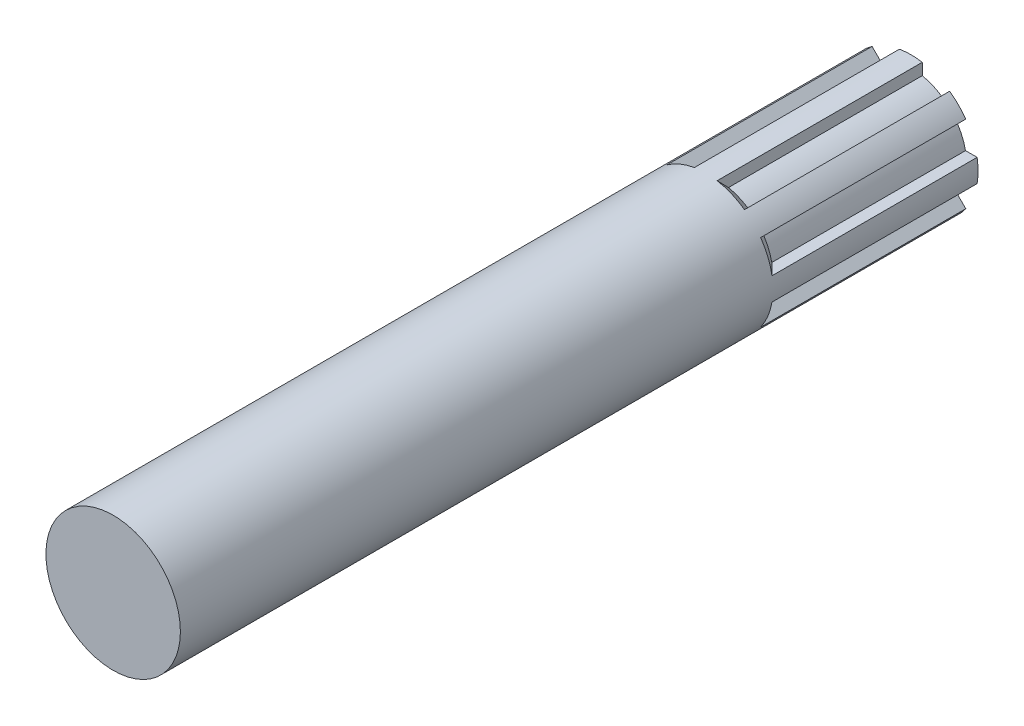
from build123d import *

# Parameters (mm, degrees)
SKETCH1_R           = 2.95
BOSS_EXTRUDE1_DEPTH = 35
CUT_EXTRUDE1_DEPTH  = 8
CHAMFER1_SIZE       = 1


with BuildPart() as part:
    # Sketch1 → Boss-Extrude1 (new body)
    with BuildSketch(Plane.XY):
        Circle(SKETCH1_R)
    extrude(amount=BOSS_EXTRUDE1_DEPTH)

    # Sketch2 → Cut-Extrude1 (cut)
    with BuildSketch(Plane(origin=(0, 0, 0), x_dir=(-1, 0, 0), z_dir=(0, 0, -1))):
        with BuildLine():
            ThreePointArc((-2.398436991, 0.5), (-2.263504855, 0.937574409), (-2.049504451, 1.34239767))
            Line((-2.049504451, 1.34239767), (-2.409337912, 1.702231131))
            ThreePointArc((-2.409337912, 1.702231131), (-2.725444621, 1.128916125), (-2.907318352, 0.5))
            Line((-2.907318352, 0.5), (-2.398436991, 0.5))
        make_face()
        with BuildLine():
            ThreePointArc((-1.34239767, 2.049504451), (-0.937574409, 2.263504855), (-0.5, 2.398436991))
            Line((-0.5, 2.398436991), (-0.5, 2.907318352))
            ThreePointArc((-0.5, 2.907318352), (-1.128916125, 2.725444621), (-1.702231131, 2.409337912))
            Line((-1.702231131, 2.409337912), (-1.34239767, 2.049504451))
        make_face()
        with BuildLine():
            Line((0.5, 2.907318352), (0.5, 2.398436991))
            ThreePointArc((0.5, 2.398436991), (0.937574409, 2.263504855), (1.34239767, 2.049504451))
            Line((1.34239767, 2.049504451), (1.702231131, 2.409337912))
            ThreePointArc((1.702231131, 2.409337912), (1.128916125, 2.725444621), (0.5, 2.907318352))
        make_face()
        with BuildLine():
            Line((2.409337912, 1.702231131), (2.049504451, 1.34239767))
            ThreePointArc((2.049504451, 1.34239767), (2.263504855, 0.937574409), (2.398436991, 0.5))
            Line((2.398436991, 0.5), (2.907318352, 0.5))
            ThreePointArc((2.907318352, 0.5), (2.725444621, 1.128916125), (2.409337912, 1.702231131))
        make_face()
        with BuildLine():
            Line((2.907318352, -0.5), (2.398436991, -0.5))
            ThreePointArc((2.398436991, -0.5), (2.263504855, -0.937574409), (2.049504451, -1.34239767))
            Line((2.049504451, -1.34239767), (2.409337912, -1.702231131))
            ThreePointArc((2.409337912, -1.702231131), (2.725444621, -1.128916125), (2.907318352, -0.5))
        make_face()
        with BuildLine():
            Line((1.702231131, -2.409337912), (1.34239767, -2.049504451))
            ThreePointArc((1.34239767, -2.049504451), (0.937574409, -2.263504855), (0.5, -2.398436991))
            Line((0.5, -2.398436991), (0.5, -2.907318352))
            ThreePointArc((0.5, -2.907318352), (1.128916125, -2.725444621), (1.702231131, -2.409337912))
        make_face()
        with BuildLine():
            ThreePointArc((-0.5, -2.398436991), (-0.937574409, -2.263504855), (-1.34239767, -2.049504451))
            Line((-1.34239767, -2.049504451), (-1.702231131, -2.409337912))
            ThreePointArc((-1.702231131, -2.409337912), (-1.128916125, -2.725444621), (-0.5, -2.907318352))
            Line((-0.5, -2.907318352), (-0.5, -2.398436991))
        make_face()
        with BuildLine():
            ThreePointArc((-2.049504451, -1.34239767), (-2.263504855, -0.937574409), (-2.398436991, -0.5))
            Line((-2.398436991, -0.5), (-2.907318352, -0.5))
            ThreePointArc((-2.907318352, -0.5), (-2.725444621, -1.128916125), (-2.409337912, -1.702231131))
            Line((-2.409337912, -1.702231131), (-2.049504451, -1.34239767))
        make_face()
    extrude(amount=-CUT_EXTRUDE1_DEPTH, mode=Mode.SUBTRACT)

    # Chamfer1
    # the kernel refuses this chamfer: 1 mm, written as the material it takes off along each edge
    with BuildSketch(Plane(origin=(0, 0, 8), x_dir=(0.6453423073627431, -0.7638935176631171, 0), z_dir=(0.7638935176631171, 0.6453423073627431, 0))) as chamfer1_piece_1_section:
        Polygon((2.95, -CHAMFER1_SIZE), (2.95 - CHAMFER1_SIZE, 0), (2.95, 0), align=None)
    chamfer1_piece_1 = revolve(axis=Axis((0, 0, 8), (0, 0, -1)), revolution_arc=125.382690704, mode=Mode.PRIVATE)
    chamfer1_piece_1 = split(chamfer1_piece_1, bisect_by=Plane(origin=(0.5, 0, 8), z_dir=(1, 0, 0)), keep=Keep.TOP, mode=Mode.PRIVATE)
    chamfer1_piece_1 = split(chamfer1_piece_1, bisect_by=Plane(origin=(-0.353553391, -0.353553391, 8), z_dir=(-0.7071067811865415, -0.7071067811865537, 0)), keep=Keep.TOP, mode=Mode.PRIVATE)
    chamfer1_piece_1 = chamfer1_piece_1 - Plane(origin=(0, 0, 8), x_dir=(0.20408163265306725, -0.9789538738948115, 0), z_dir=(0, 0, -1)) * Cylinder(2.45, 12, mode=Mode.PRIVATE)
    add(chamfer1_piece_1, mode=Mode.SUBTRACT)
    with BuildSketch(Plane(origin=(0, 0, 8), x_dir=(0.6453423073627431, -0.7638935176631171, 0), z_dir=(0.7638935176631171, 0.6453423073627431, 0))) as chamfer1_piece_2_section:
        Polygon((2.95, -CHAMFER1_SIZE), (2.95 - CHAMFER1_SIZE, 0), (2.95, 0), align=None)
    chamfer1_piece_2 = revolve(axis=Axis((0, 0, 8), (0, 0, -1)), revolution_arc=125.382690704, mode=Mode.PRIVATE)
    chamfer1_piece_2 = split(chamfer1_piece_2, bisect_by=Plane(origin=(0.353553391, -0.353553391, 8), z_dir=(0.7071067811865517, -0.7071067811865434, 0)), keep=Keep.TOP, mode=Mode.PRIVATE)
    chamfer1_piece_2 = split(chamfer1_piece_2, bisect_by=Plane(origin=(-0.5, 0, 8), z_dir=(-1, 0, 0)), keep=Keep.TOP, mode=Mode.PRIVATE)
    chamfer1_piece_2 = chamfer1_piece_2 - Plane(origin=(0, 0, 8), x_dir=(0.20408163265306725, -0.9789538738948115, 0), z_dir=(0, 0, -1)) * Cylinder(2.45, 12, mode=Mode.PRIVATE)
    add(chamfer1_piece_2, mode=Mode.SUBTRACT)
    with BuildSketch(Plane(origin=(0, 0, 8), x_dir=(0.6453423073627431, -0.7638935176631171, 0), z_dir=(0.7638935176631171, 0.6453423073627431, 0))) as chamfer1_piece_3_section:
        Polygon((2.95, -CHAMFER1_SIZE), (2.95 - CHAMFER1_SIZE, 0), (2.95, 0), align=None)
    chamfer1_piece_3 = revolve(axis=Axis((0, 0, 8), (0, 0, -1)), revolution_arc=125.382690704, mode=Mode.PRIVATE)
    chamfer1_piece_3 = split(chamfer1_piece_3, bisect_by=Plane(origin=(0, -0.5, 8), z_dir=(0, -1, 0)), keep=Keep.TOP, mode=Mode.PRIVATE)
    chamfer1_piece_3 = split(chamfer1_piece_3, bisect_by=Plane(origin=(-0.353553391, 0.353553391, 8), z_dir=(-0.7071067811865515, 0.7071067811865437, 0)), keep=Keep.TOP, mode=Mode.PRIVATE)
    chamfer1_piece_3 = chamfer1_piece_3 - Plane(origin=(0, 0, 8), x_dir=(0.20408163265306725, -0.9789538738948115, 0), z_dir=(0, 0, -1)) * Cylinder(2.45, 12, mode=Mode.PRIVATE)
    add(chamfer1_piece_3, mode=Mode.SUBTRACT)
    with BuildSketch(Plane(origin=(0, 0, 8), x_dir=(-0.083828364721268, -0.9964802081668046, 0), z_dir=(0.9964802081668046, -0.083828364721268, 0))) as chamfer1_piece_4_section:
        Polygon((2.95, -CHAMFER1_SIZE), (2.95 - CHAMFER1_SIZE, 0), (2.95, 0), align=None)
    chamfer1_piece_4 = revolve(axis=Axis((0, 0, 8), (0, 0, -1)), revolution_arc=125.382690704, mode=Mode.PRIVATE)
    chamfer1_piece_4 = split(chamfer1_piece_4, bisect_by=Plane(origin=(0.353553391, -0.353553391, 8), z_dir=(0.7071067811865517, -0.7071067811865434, 0)), keep=Keep.TOP, mode=Mode.PRIVATE)
    chamfer1_piece_4 = split(chamfer1_piece_4, bisect_by=Plane(origin=(-0.5, 0, 8), z_dir=(-1, 0, 0)), keep=Keep.TOP, mode=Mode.PRIVATE)
    chamfer1_piece_4 = chamfer1_piece_4 - Plane(origin=(0, 0, 8), x_dir=(-0.5479174163352548, -0.8365324290644679, 0), z_dir=(0, 0, -1)) * Cylinder(2.45, 12, mode=Mode.PRIVATE)
    add(chamfer1_piece_4, mode=Mode.SUBTRACT)
    with BuildSketch(Plane(origin=(0, 0, 8), x_dir=(-0.083828364721268, -0.9964802081668046, 0), z_dir=(0.9964802081668046, -0.083828364721268, 0))) as chamfer1_piece_5_section:
        Polygon((2.95, -CHAMFER1_SIZE), (2.95 - CHAMFER1_SIZE, 0), (2.95, 0), align=None)
    chamfer1_piece_5 = revolve(axis=Axis((0, 0, 8), (0, 0, -1)), revolution_arc=125.382690704, mode=Mode.PRIVATE)
    chamfer1_piece_5 = split(chamfer1_piece_5, bisect_by=Plane(origin=(0, -0.5, 8), z_dir=(0, -1, 0)), keep=Keep.TOP, mode=Mode.PRIVATE)
    chamfer1_piece_5 = split(chamfer1_piece_5, bisect_by=Plane(origin=(-0.353553391, 0.353553391, 8), z_dir=(-0.7071067811865515, 0.7071067811865437, 0)), keep=Keep.TOP, mode=Mode.PRIVATE)
    chamfer1_piece_5 = chamfer1_piece_5 - Plane(origin=(0, 0, 8), x_dir=(-0.5479174163352548, -0.8365324290644679, 0), z_dir=(0, 0, -1)) * Cylinder(2.45, 12, mode=Mode.PRIVATE)
    add(chamfer1_piece_5, mode=Mode.SUBTRACT)
    with BuildSketch(Plane(origin=(0, 0, 8), x_dir=(-0.083828364721268, -0.9964802081668046, 0), z_dir=(0.9964802081668046, -0.083828364721268, 0))) as chamfer1_piece_6_section:
        Polygon((2.95, -CHAMFER1_SIZE), (2.95 - CHAMFER1_SIZE, 0), (2.95, 0), align=None)
    chamfer1_piece_6 = revolve(axis=Axis((0, 0, 8), (0, 0, -1)), revolution_arc=125.382690704, mode=Mode.PRIVATE)
    chamfer1_piece_6 = split(chamfer1_piece_6, bisect_by=Plane(origin=(-0.353553391, -0.353553391, 8), z_dir=(-0.7071067811865454, -0.7071067811865497, 0)), keep=Keep.TOP, mode=Mode.PRIVATE)
    chamfer1_piece_6 = split(chamfer1_piece_6, bisect_by=Plane(origin=(0, 0.5, 8), z_dir=(0, 1, 0)), keep=Keep.TOP, mode=Mode.PRIVATE)
    chamfer1_piece_6 = chamfer1_piece_6 - Plane(origin=(0, 0, 8), x_dir=(-0.5479174163352548, -0.8365324290644679, 0), z_dir=(0, 0, -1)) * Cylinder(2.45, 12, mode=Mode.PRIVATE)
    add(chamfer1_piece_6, mode=Mode.SUBTRACT)
    with BuildSketch(Plane(origin=(0, 0, 8), x_dir=(-0.7638935176631205, -0.645342307362739, 0), z_dir=(0.645342307362739, -0.7638935176631205, 0))) as chamfer1_piece_7_section:
        Polygon((2.95, -CHAMFER1_SIZE), (2.95 - CHAMFER1_SIZE, 0), (2.95, 0), align=None)
    chamfer1_piece_7 = revolve(axis=Axis((0, 0, 8), (0, 0, -1)), revolution_arc=125.382690704, mode=Mode.PRIVATE)
    chamfer1_piece_7 = split(chamfer1_piece_7, bisect_by=Plane(origin=(0, -0.5, 8), z_dir=(0, -1, 0)), keep=Keep.TOP, mode=Mode.PRIVATE)
    chamfer1_piece_7 = split(chamfer1_piece_7, bisect_by=Plane(origin=(-0.353553391, 0.353553391, 8), z_dir=(-0.7071067811865515, 0.7071067811865437, 0)), keep=Keep.TOP, mode=Mode.PRIVATE)
    chamfer1_piece_7 = chamfer1_piece_7 - Plane(origin=(0, 0, 8), x_dir=(-0.9789538738948118, -0.20408163265306617, 0), z_dir=(0, 0, -1)) * Cylinder(2.45, 12, mode=Mode.PRIVATE)
    add(chamfer1_piece_7, mode=Mode.SUBTRACT)
    with BuildSketch(Plane(origin=(0, 0, 8), x_dir=(-0.7638935176631205, -0.645342307362739, 0), z_dir=(0.645342307362739, -0.7638935176631205, 0))) as chamfer1_piece_8_section:
        Polygon((2.95, -CHAMFER1_SIZE), (2.95 - CHAMFER1_SIZE, 0), (2.95, 0), align=None)
    chamfer1_piece_8 = revolve(axis=Axis((0, 0, 8), (0, 0, -1)), revolution_arc=125.382690704, mode=Mode.PRIVATE)
    chamfer1_piece_8 = split(chamfer1_piece_8, bisect_by=Plane(origin=(-0.353553391, -0.353553391, 8), z_dir=(-0.7071067811865454, -0.7071067811865497, 0)), keep=Keep.TOP, mode=Mode.PRIVATE)
    chamfer1_piece_8 = split(chamfer1_piece_8, bisect_by=Plane(origin=(0, 0.5, 8), z_dir=(0, 1, 0)), keep=Keep.TOP, mode=Mode.PRIVATE)
    chamfer1_piece_8 = chamfer1_piece_8 - Plane(origin=(0, 0, 8), x_dir=(-0.9789538738948118, -0.20408163265306617, 0), z_dir=(0, 0, -1)) * Cylinder(2.45, 12, mode=Mode.PRIVATE)
    add(chamfer1_piece_8, mode=Mode.SUBTRACT)
    with BuildSketch(Plane(origin=(0, 0, 8), x_dir=(-0.7638935176631205, -0.645342307362739, 0), z_dir=(0.645342307362739, -0.7638935176631205, 0))) as chamfer1_piece_9_section:
        Polygon((2.95, -CHAMFER1_SIZE), (2.95 - CHAMFER1_SIZE, 0), (2.95, 0), align=None)
    chamfer1_piece_9 = revolve(axis=Axis((0, 0, 8), (0, 0, -1)), revolution_arc=125.382690704, mode=Mode.PRIVATE)
    chamfer1_piece_9 = split(chamfer1_piece_9, bisect_by=Plane(origin=(-0.5, 0, 8), z_dir=(-1, 0, 0)), keep=Keep.TOP, mode=Mode.PRIVATE)
    chamfer1_piece_9 = split(chamfer1_piece_9, bisect_by=Plane(origin=(0.353553391, 0.353553391, 8), z_dir=(0.7071067811865474, 0.7071067811865477, 0)), keep=Keep.TOP, mode=Mode.PRIVATE)
    chamfer1_piece_9 = chamfer1_piece_9 - Plane(origin=(0, 0, 8), x_dir=(-0.9789538738948118, -0.20408163265306617, 0), z_dir=(0, 0, -1)) * Cylinder(2.45, 12, mode=Mode.PRIVATE)
    add(chamfer1_piece_9, mode=Mode.SUBTRACT)
    with BuildSketch(Plane(origin=(0, 0, 8), x_dir=(-0.9964802081668033, 0.08382836472128195, 0), z_dir=(-0.08382836472128195, -0.9964802081668033, 0))) as chamfer1_piece_10_section:
        Polygon((2.95, -CHAMFER1_SIZE), (2.95 - CHAMFER1_SIZE, 0), (2.95, 0), align=None)
    chamfer1_piece_10 = revolve(axis=Axis((0, 0, 8), (0, 0, -1)), revolution_arc=125.382690704, mode=Mode.PRIVATE)
    chamfer1_piece_10 = split(chamfer1_piece_10, bisect_by=Plane(origin=(-0.353553391, -0.353553391, 8), z_dir=(-0.7071067811865454, -0.7071067811865497, 0)), keep=Keep.TOP, mode=Mode.PRIVATE)
    chamfer1_piece_10 = split(chamfer1_piece_10, bisect_by=Plane(origin=(0, 0.5, 8), z_dir=(0, 1, 0)), keep=Keep.TOP, mode=Mode.PRIVATE)
    chamfer1_piece_10 = chamfer1_piece_10 - Plane(origin=(0, 0, 8), x_dir=(-0.836532429064466, 0.5479174163352577, 0), z_dir=(0, 0, -1)) * Cylinder(2.45, 12, mode=Mode.PRIVATE)
    add(chamfer1_piece_10, mode=Mode.SUBTRACT)
    with BuildSketch(Plane(origin=(0, 0, 8), x_dir=(-0.9964802081668033, 0.08382836472128195, 0), z_dir=(-0.08382836472128195, -0.9964802081668033, 0))) as chamfer1_piece_11_section:
        Polygon((2.95, -CHAMFER1_SIZE), (2.95 - CHAMFER1_SIZE, 0), (2.95, 0), align=None)
    chamfer1_piece_11 = revolve(axis=Axis((0, 0, 8), (0, 0, -1)), revolution_arc=125.382690704, mode=Mode.PRIVATE)
    chamfer1_piece_11 = split(chamfer1_piece_11, bisect_by=Plane(origin=(-0.5, 0, 8), z_dir=(-1, 0, 0)), keep=Keep.TOP, mode=Mode.PRIVATE)
    chamfer1_piece_11 = split(chamfer1_piece_11, bisect_by=Plane(origin=(0.353553391, 0.353553391, 8), z_dir=(0.7071067811865474, 0.7071067811865477, 0)), keep=Keep.TOP, mode=Mode.PRIVATE)
    chamfer1_piece_11 = chamfer1_piece_11 - Plane(origin=(0, 0, 8), x_dir=(-0.836532429064466, 0.5479174163352577, 0), z_dir=(0, 0, -1)) * Cylinder(2.45, 12, mode=Mode.PRIVATE)
    add(chamfer1_piece_11, mode=Mode.SUBTRACT)
    with BuildSketch(Plane(origin=(0, 0, 8), x_dir=(-0.9964802081668033, 0.08382836472128195, 0), z_dir=(-0.08382836472128195, -0.9964802081668033, 0))) as chamfer1_piece_12_section:
        Polygon((2.95, -CHAMFER1_SIZE), (2.95 - CHAMFER1_SIZE, 0), (2.95, 0), align=None)
    chamfer1_piece_12 = revolve(axis=Axis((0, 0, 8), (0, 0, -1)), revolution_arc=125.382690704, mode=Mode.PRIVATE)
    chamfer1_piece_12 = split(chamfer1_piece_12, bisect_by=Plane(origin=(-0.353553391, 0.353553391, 8), z_dir=(-0.7071067811865565, 0.7071067811865386, 0)), keep=Keep.TOP, mode=Mode.PRIVATE)
    chamfer1_piece_12 = split(chamfer1_piece_12, bisect_by=Plane(origin=(0.5, 0, 8), z_dir=(1, 0, 0)), keep=Keep.TOP, mode=Mode.PRIVATE)
    chamfer1_piece_12 = chamfer1_piece_12 - Plane(origin=(0, 0, 8), x_dir=(-0.836532429064466, 0.5479174163352577, 0), z_dir=(0, 0, -1)) * Cylinder(2.45, 12, mode=Mode.PRIVATE)
    add(chamfer1_piece_12, mode=Mode.SUBTRACT)
    with BuildSketch(Plane(origin=(0, 0, 8), x_dir=(0.9964802081668043, -0.08382836472127134, 0), z_dir=(0.08382836472127134, 0.9964802081668043, 0))) as chamfer1_piece_13_section:
        Polygon((2.95, -CHAMFER1_SIZE), (2.95 - CHAMFER1_SIZE, 0), (2.95, 0), align=None)
    chamfer1_piece_13 = revolve(axis=Axis((0, 0, 8), (0, 0, -1)), revolution_arc=125.382690704, mode=Mode.PRIVATE)
    chamfer1_piece_13 = split(chamfer1_piece_13, bisect_by=Plane(origin=(0.353553391, 0.353553391, 8), z_dir=(0.707106781186541, 0.7071067811865541, 0)), keep=Keep.TOP, mode=Mode.PRIVATE)
    chamfer1_piece_13 = split(chamfer1_piece_13, bisect_by=Plane(origin=(0, -0.5, 8), z_dir=(0, -1, 0)), keep=Keep.TOP, mode=Mode.PRIVATE)
    chamfer1_piece_13 = chamfer1_piece_13 - Plane(origin=(0, 0, 8), x_dir=(0.8365324290644678, -0.5479174163352549, 0), z_dir=(0, 0, -1)) * Cylinder(2.45, 12, mode=Mode.PRIVATE)
    add(chamfer1_piece_13, mode=Mode.SUBTRACT)
    with BuildSketch(Plane(origin=(0, 0, 8), x_dir=(0.9964802081668043, -0.08382836472127134, 0), z_dir=(0.08382836472127134, 0.9964802081668043, 0))) as chamfer1_piece_14_section:
        Polygon((2.95, -CHAMFER1_SIZE), (2.95 - CHAMFER1_SIZE, 0), (2.95, 0), align=None)
    chamfer1_piece_14 = revolve(axis=Axis((0, 0, 8), (0, 0, -1)), revolution_arc=125.382690704, mode=Mode.PRIVATE)
    chamfer1_piece_14 = split(chamfer1_piece_14, bisect_by=Plane(origin=(0.5, 0, 8), z_dir=(1, 0, 0)), keep=Keep.TOP, mode=Mode.PRIVATE)
    chamfer1_piece_14 = split(chamfer1_piece_14, bisect_by=Plane(origin=(-0.353553391, -0.353553391, 8), z_dir=(-0.7071067811865415, -0.7071067811865537, 0)), keep=Keep.TOP, mode=Mode.PRIVATE)
    chamfer1_piece_14 = chamfer1_piece_14 - Plane(origin=(0, 0, 8), x_dir=(0.8365324290644678, -0.5479174163352549, 0), z_dir=(0, 0, -1)) * Cylinder(2.45, 12, mode=Mode.PRIVATE)
    add(chamfer1_piece_14, mode=Mode.SUBTRACT)
    with BuildSketch(Plane(origin=(0, 0, 8), x_dir=(0.9964802081668043, -0.08382836472127134, 0), z_dir=(0.08382836472127134, 0.9964802081668043, 0))) as chamfer1_piece_15_section:
        Polygon((2.95, -CHAMFER1_SIZE), (2.95 - CHAMFER1_SIZE, 0), (2.95, 0), align=None)
    chamfer1_piece_15 = revolve(axis=Axis((0, 0, 8), (0, 0, -1)), revolution_arc=125.382690704, mode=Mode.PRIVATE)
    chamfer1_piece_15 = split(chamfer1_piece_15, bisect_by=Plane(origin=(0.353553391, -0.353553391, 8), z_dir=(0.7071067811865517, -0.7071067811865434, 0)), keep=Keep.TOP, mode=Mode.PRIVATE)
    chamfer1_piece_15 = split(chamfer1_piece_15, bisect_by=Plane(origin=(-0.5, 0, 8), z_dir=(-1, 0, 0)), keep=Keep.TOP, mode=Mode.PRIVATE)
    chamfer1_piece_15 = chamfer1_piece_15 - Plane(origin=(0, 0, 8), x_dir=(0.8365324290644678, -0.5479174163352549, 0), z_dir=(0, 0, -1)) * Cylinder(2.45, 12, mode=Mode.PRIVATE)
    add(chamfer1_piece_15, mode=Mode.SUBTRACT)
    with BuildSketch(Plane(origin=(0, 0, 8), x_dir=(0.7638935176631216, 0.6453423073627377, 0), z_dir=(-0.6453423073627377, 0.7638935176631216, 0))) as chamfer1_piece_16_section:
        Polygon((2.95, -CHAMFER1_SIZE), (2.95 - CHAMFER1_SIZE, 0), (2.95, 0), align=None)
    chamfer1_piece_16 = revolve(axis=Axis((0, 0, 8), (0, 0, -1)), revolution_arc=125.382690704, mode=Mode.PRIVATE)
    chamfer1_piece_16 = split(chamfer1_piece_16, bisect_by=Plane(origin=(0, 0.5, 8), z_dir=(0, 1, 0)), keep=Keep.TOP, mode=Mode.PRIVATE)
    chamfer1_piece_16 = split(chamfer1_piece_16, bisect_by=Plane(origin=(0.353553391, -0.353553391, 8), z_dir=(0.707106781186556, -0.707106781186539, 0)), keep=Keep.TOP, mode=Mode.PRIVATE)
    chamfer1_piece_16 = chamfer1_piece_16 - Plane(origin=(0, 0, 8), x_dir=(0.8365324290644678, -0.5479174163352549, 0), z_dir=(0, 0, -1)) * Cylinder(2.45, 12, mode=Mode.PRIVATE)
    add(chamfer1_piece_16, mode=Mode.SUBTRACT)
    with BuildSketch(Plane(origin=(0, 0, 8), x_dir=(0.7638935176631216, 0.6453423073627377, 0), z_dir=(-0.6453423073627377, 0.7638935176631216, 0))) as chamfer1_piece_17_section:
        Polygon((2.95, -CHAMFER1_SIZE), (2.95 - CHAMFER1_SIZE, 0), (2.95, 0), align=None)
    chamfer1_piece_17 = revolve(axis=Axis((0, 0, 8), (0, 0, -1)), revolution_arc=125.382690704, mode=Mode.PRIVATE)
    chamfer1_piece_17 = split(chamfer1_piece_17, bisect_by=Plane(origin=(0.353553391, 0.353553391, 8), z_dir=(0.707106781186541, 0.7071067811865541, 0)), keep=Keep.TOP, mode=Mode.PRIVATE)
    chamfer1_piece_17 = split(chamfer1_piece_17, bisect_by=Plane(origin=(0, -0.5, 8), z_dir=(0, -1, 0)), keep=Keep.TOP, mode=Mode.PRIVATE)
    chamfer1_piece_17 = chamfer1_piece_17 - Plane(origin=(0, 0, 8), x_dir=(0.8365324290644678, -0.5479174163352549, 0), z_dir=(0, 0, -1)) * Cylinder(2.45, 12, mode=Mode.PRIVATE)
    add(chamfer1_piece_17, mode=Mode.SUBTRACT)
    with BuildSketch(Plane(origin=(0, 0, 8), x_dir=(0.7638935176631216, 0.6453423073627377, 0), z_dir=(-0.6453423073627377, 0.7638935176631216, 0))) as chamfer1_piece_18_section:
        Polygon((2.95, -CHAMFER1_SIZE), (2.95 - CHAMFER1_SIZE, 0), (2.95, 0), align=None)
    chamfer1_piece_18 = revolve(axis=Axis((0, 0, 8), (0, 0, -1)), revolution_arc=125.382690704, mode=Mode.PRIVATE)
    chamfer1_piece_18 = split(chamfer1_piece_18, bisect_by=Plane(origin=(0.5, 0, 8), z_dir=(1, 0, 0)), keep=Keep.TOP, mode=Mode.PRIVATE)
    chamfer1_piece_18 = split(chamfer1_piece_18, bisect_by=Plane(origin=(-0.353553391, -0.353553391, 8), z_dir=(-0.7071067811865415, -0.7071067811865537, 0)), keep=Keep.TOP, mode=Mode.PRIVATE)
    chamfer1_piece_18 = chamfer1_piece_18 - Plane(origin=(0, 0, 8), x_dir=(0.8365324290644678, -0.5479174163352549, 0), z_dir=(0, 0, -1)) * Cylinder(2.45, 12, mode=Mode.PRIVATE)
    add(chamfer1_piece_18, mode=Mode.SUBTRACT)
    with BuildSketch(Plane(origin=(0, 0, 8), x_dir=(0.08382836472126272, 0.996480208166805, 0), z_dir=(-0.996480208166805, 0.08382836472126272, 0))) as chamfer1_piece_19_section:
        Polygon((2.95, -CHAMFER1_SIZE), (2.95 - CHAMFER1_SIZE, 0), (2.95, 0), align=None)
    chamfer1_piece_19 = revolve(axis=Axis((0, 0, 8), (0, 0, -1)), revolution_arc=125.382690704, mode=Mode.PRIVATE)
    chamfer1_piece_19 = split(chamfer1_piece_19, bisect_by=Plane(origin=(-0.353553391, 0.353553391, 8), z_dir=(-0.7071067811865565, 0.7071067811865386, 0)), keep=Keep.TOP, mode=Mode.PRIVATE)
    chamfer1_piece_19 = split(chamfer1_piece_19, bisect_by=Plane(origin=(0.5, 0, 8), z_dir=(1, 0, 0)), keep=Keep.TOP, mode=Mode.PRIVATE)
    chamfer1_piece_19 = chamfer1_piece_19 - Plane(origin=(0, 0, 8), x_dir=(0.8365324290644678, -0.5479174163352549, 0), z_dir=(0, 0, -1)) * Cylinder(2.45, 12, mode=Mode.PRIVATE)
    add(chamfer1_piece_19, mode=Mode.SUBTRACT)
    with BuildSketch(Plane(origin=(0, 0, 8), x_dir=(0.08382836472126272, 0.996480208166805, 0), z_dir=(-0.996480208166805, 0.08382836472126272, 0))) as chamfer1_piece_20_section:
        Polygon((2.95, -CHAMFER1_SIZE), (2.95 - CHAMFER1_SIZE, 0), (2.95, 0), align=None)
    chamfer1_piece_20 = revolve(axis=Axis((0, 0, 8), (0, 0, -1)), revolution_arc=125.382690704, mode=Mode.PRIVATE)
    chamfer1_piece_20 = split(chamfer1_piece_20, bisect_by=Plane(origin=(0, 0.5, 8), z_dir=(0, 1, 0)), keep=Keep.TOP, mode=Mode.PRIVATE)
    chamfer1_piece_20 = split(chamfer1_piece_20, bisect_by=Plane(origin=(0.353553391, -0.353553391, 8), z_dir=(0.707106781186556, -0.707106781186539, 0)), keep=Keep.TOP, mode=Mode.PRIVATE)
    chamfer1_piece_20 = chamfer1_piece_20 - Plane(origin=(0, 0, 8), x_dir=(0.8365324290644678, -0.5479174163352549, 0), z_dir=(0, 0, -1)) * Cylinder(2.45, 12, mode=Mode.PRIVATE)
    add(chamfer1_piece_20, mode=Mode.SUBTRACT)
    with BuildSketch(Plane(origin=(0, 0, 8), x_dir=(0.08382836472126272, 0.996480208166805, 0), z_dir=(-0.996480208166805, 0.08382836472126272, 0))) as chamfer1_piece_21_section:
        Polygon((2.95, -CHAMFER1_SIZE), (2.95 - CHAMFER1_SIZE, 0), (2.95, 0), align=None)
    chamfer1_piece_21 = revolve(axis=Axis((0, 0, 8), (0, 0, -1)), revolution_arc=125.382690704, mode=Mode.PRIVATE)
    chamfer1_piece_21 = split(chamfer1_piece_21, bisect_by=Plane(origin=(0.353553391, 0.353553391, 8), z_dir=(0.707106781186541, 0.7071067811865541, 0)), keep=Keep.TOP, mode=Mode.PRIVATE)
    chamfer1_piece_21 = split(chamfer1_piece_21, bisect_by=Plane(origin=(0, -0.5, 8), z_dir=(0, -1, 0)), keep=Keep.TOP, mode=Mode.PRIVATE)
    chamfer1_piece_21 = chamfer1_piece_21 - Plane(origin=(0, 0, 8), x_dir=(0.8365324290644678, -0.5479174163352549, 0), z_dir=(0, 0, -1)) * Cylinder(2.45, 12, mode=Mode.PRIVATE)
    add(chamfer1_piece_21, mode=Mode.SUBTRACT)
    with BuildSketch(Plane(origin=(0, 0, 8), x_dir=(-0.6453423073627307, 0.7638935176631274, 0), z_dir=(-0.7638935176631274, -0.6453423073627307, 0))) as chamfer1_piece_22_section:
        Polygon((2.95, -CHAMFER1_SIZE), (2.95 - CHAMFER1_SIZE, 0), (2.95, 0), align=None)
    chamfer1_piece_22 = revolve(axis=Axis((0, 0, 8), (0, 0, -1)), revolution_arc=125.382690704, mode=Mode.PRIVATE)
    chamfer1_piece_22 = split(chamfer1_piece_22, bisect_by=Plane(origin=(-0.5, 0, 8), z_dir=(-1, 0, 0)), keep=Keep.TOP, mode=Mode.PRIVATE)
    chamfer1_piece_22 = split(chamfer1_piece_22, bisect_by=Plane(origin=(0.353553391, 0.353553391, 8), z_dir=(0.7071067811865474, 0.7071067811865477, 0)), keep=Keep.TOP, mode=Mode.PRIVATE)
    chamfer1_piece_22 = chamfer1_piece_22 - Plane(origin=(0, 0, 8), x_dir=(-0.2040816326530623, 0.9789538738948126, 0), z_dir=(0, 0, -1)) * Cylinder(2.45, 12, mode=Mode.PRIVATE)
    add(chamfer1_piece_22, mode=Mode.SUBTRACT)
    with BuildSketch(Plane(origin=(0, 0, 8), x_dir=(-0.6453423073627307, 0.7638935176631274, 0), z_dir=(-0.7638935176631274, -0.6453423073627307, 0))) as chamfer1_piece_23_section:
        Polygon((2.95, -CHAMFER1_SIZE), (2.95 - CHAMFER1_SIZE, 0), (2.95, 0), align=None)
    chamfer1_piece_23 = revolve(axis=Axis((0, 0, 8), (0, 0, -1)), revolution_arc=125.382690704, mode=Mode.PRIVATE)
    chamfer1_piece_23 = split(chamfer1_piece_23, bisect_by=Plane(origin=(-0.353553391, 0.353553391, 8), z_dir=(-0.7071067811865565, 0.7071067811865386, 0)), keep=Keep.TOP, mode=Mode.PRIVATE)
    chamfer1_piece_23 = split(chamfer1_piece_23, bisect_by=Plane(origin=(0.5, 0, 8), z_dir=(1, 0, 0)), keep=Keep.TOP, mode=Mode.PRIVATE)
    chamfer1_piece_23 = chamfer1_piece_23 - Plane(origin=(0, 0, 8), x_dir=(-0.2040816326530623, 0.9789538738948126, 0), z_dir=(0, 0, -1)) * Cylinder(2.45, 12, mode=Mode.PRIVATE)
    add(chamfer1_piece_23, mode=Mode.SUBTRACT)
    with BuildSketch(Plane(origin=(0, 0, 8), x_dir=(-0.6453423073627307, 0.7638935176631274, 0), z_dir=(-0.7638935176631274, -0.6453423073627307, 0))) as chamfer1_piece_24_section:
        Polygon((2.95, -CHAMFER1_SIZE), (2.95 - CHAMFER1_SIZE, 0), (2.95, 0), align=None)
    chamfer1_piece_24 = revolve(axis=Axis((0, 0, 8), (0, 0, -1)), revolution_arc=125.382690704, mode=Mode.PRIVATE)
    chamfer1_piece_24 = split(chamfer1_piece_24, bisect_by=Plane(origin=(0, 0.5, 8), z_dir=(0, 1, 0)), keep=Keep.TOP, mode=Mode.PRIVATE)
    chamfer1_piece_24 = split(chamfer1_piece_24, bisect_by=Plane(origin=(0.353553391, -0.353553391, 8), z_dir=(0.707106781186556, -0.707106781186539, 0)), keep=Keep.TOP, mode=Mode.PRIVATE)
    chamfer1_piece_24 = chamfer1_piece_24 - Plane(origin=(0, 0, 8), x_dir=(-0.2040816326530623, 0.9789538738948126, 0), z_dir=(0, 0, -1)) * Cylinder(2.45, 12, mode=Mode.PRIVATE)
    add(chamfer1_piece_24, mode=Mode.SUBTRACT)


solid = part.part
